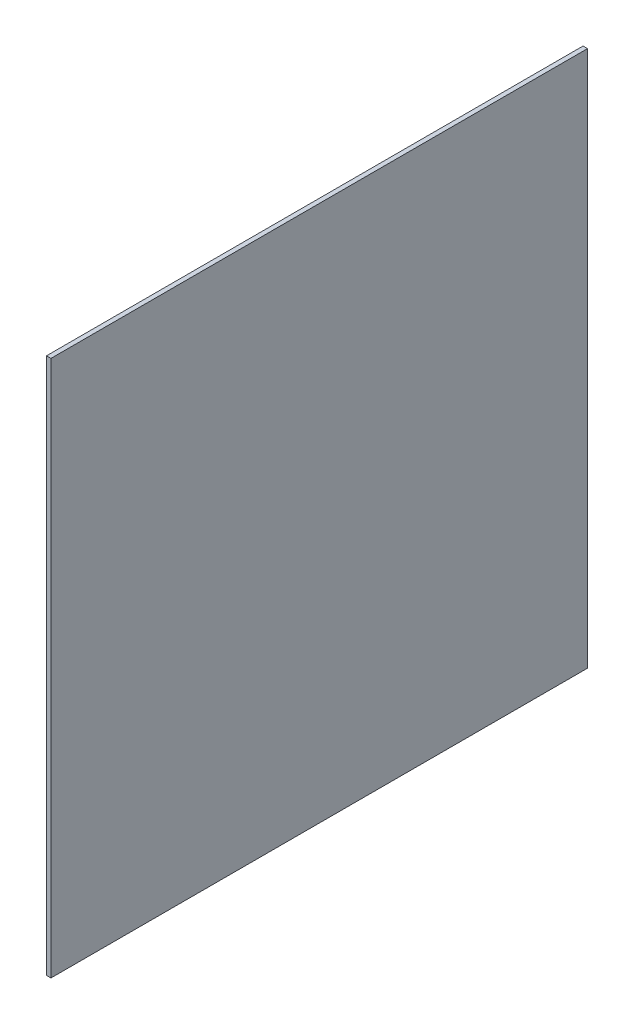
from build123d import *

# Parameters (mm, degrees)
SKETCH1_W           = 381
SKETCH1_H           = 381
BOSS_EXTRUDE1_DEPTH = 3.175


with BuildPart() as part:
    # Sketch1 → Boss-Extrude1 (new body)
    with BuildSketch(Plane(origin=(0, 0, 0), x_dir=(0, 0, -1), z_dir=(1, 0, 0))):
        with Locations((-56.605714286, 28.847142857)):
            Rectangle(SKETCH1_W, SKETCH1_H)
    extrude(amount=BOSS_EXTRUDE1_DEPTH)


solid = part.part
